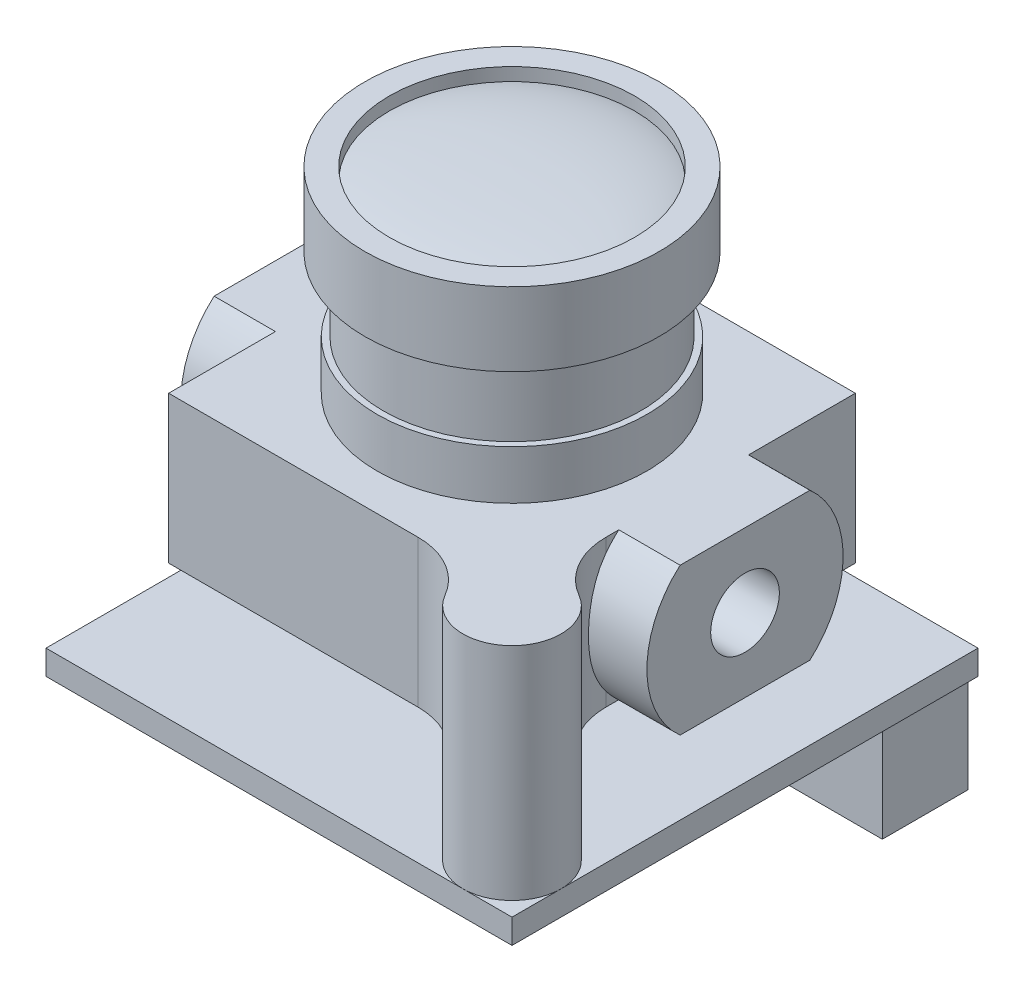
from build123d import *

# Parameters (mm, degrees)
SKETCH1_W            = 19
SKETCH1_H            = 19
BOSS_EXTRUDE1_DEPTH  = 1
SKETCH2_R            = 2
BOSS_EXTRUDE2_DEPTH  = 3
SKETCH3_R            = 2
SKETCH3_W            = 14
SKETCH3_H            = 14
BOSS_EXTRUDE3_DEPTH  = 6
SKETCH4_R            = 1.4
BOSS_EXTRUDE4_DEPTH  = 2.5
BOSS_EXTRUDE5_START  = 2.5
SKETCH5_R            = 1.4
BOSS_EXTRUDE5_DEPTH  = 2.5
SKETCH6_R            = 5.5
BOSS_EXTRUDE6_DEPTH  = 2
SKETCH7_R            = 5.25
BOSS_EXTRUDE7_DEPTH  = 3
SKETCH8_R            = 6
BOSS_EXTRUDE8_DEPTH  = 3
SKETCH12_W           = 9
SKETCH12_H           = 3.5
BOSS_EXTRUDE9_DEPTH  = 4
FILLET1_START        = 4
FILLET1_DEPTH        = 6
SKETCH14_R           = 5.25
BOSS_EXTRUDE11_DEPTH = 0.5


with BuildPart() as part:
    # Sketch1 → Boss-Extrude1 (new body)
    with BuildSketch(Plane(origin=(0, 0, 0), x_dir=(1, 0, 0), z_dir=(0, 1, 0))):
        Rectangle(SKETCH1_W, SKETCH1_H)
    extrude(amount=BOSS_EXTRUDE1_DEPTH)

    # Sketch2 → Boss-Extrude2 (add)
    with BuildSketch(Plane(origin=(0, 1, 0), x_dir=(1, 0, 0), z_dir=(0, 1, 0))):
        with Locations(Location((-7.5, 7.5, 0), (0, 0, 90))):
            Circle(SKETCH2_R)
        with Locations(Location((7.5, -7.5, 0), (0, 0, 90))):
            Circle(SKETCH2_R)
    extrude(amount=BOSS_EXTRUDE2_DEPTH)

    # Sketch3 → Boss-Extrude3 (add)
    with BuildSketch(Plane(origin=(0, 4, 0), x_dir=(1, 0, 0), z_dir=(0, 1, 0))):
        with Locations(Location((7.5, -7.5, 0), (0, 0, 104.477512186))):
            Circle(SKETCH3_R)
        with Locations(Location((-7.5, 7.5, 0), (0, 0, 90))):
            Circle(SKETCH3_R)
        Rectangle(SKETCH3_W, SKETCH3_H)
    extrude(amount=BOSS_EXTRUDE3_DEPTH)

    # Sketch4 → Boss-Extrude4 (add)
    with BuildSketch(Plane.ZY.offset(7)):
        with BuildLine():
            ThreePointArc((4, 7), (3.645751311, 8.645751311), (2.645751311, 10))
            Line((2.645751311, 10), (-2.645751311, 10))
            ThreePointArc((-2.645751311, 10), (-3.645751311, 8.645751311), (-4, 7))
            ThreePointArc((-4, 7), (-3.645751311, 5.354248689), (-2.645751311, 4))
            Line((-2.645751311, 4), (2.645751311, 4))
            ThreePointArc((2.645751311, 4), (3.645751311, 5.354248689), (4, 7))
        make_face()
        with Locations(Location((0, 7, 0), (0, 0, 180))):
            Circle(SKETCH4_R, mode=Mode.SUBTRACT)
    extrude(amount=BOSS_EXTRUDE4_DEPTH)

    # Sketch5 → Boss-Extrude5 (add)
    with BuildSketch(Plane(origin=(7, 0, 0), x_dir=(0, 0, -1), z_dir=(1, 0, 0)).offset(BOSS_EXTRUDE5_START)):
        with BuildLine():
            Line((-2.645751311, 4), (2.645751311, 4))
            ThreePointArc((2.645751311, 4), (4, 7), (2.645751311, 10))
            Line((2.645751311, 10), (-2.645751311, 10))
            ThreePointArc((-2.645751311, 10), (-4, 7), (-2.645751311, 4))
        make_face()
        with Locations((0, 7)):
            Circle(SKETCH5_R, mode=Mode.SUBTRACT)
    extrude(amount=-BOSS_EXTRUDE5_DEPTH)

    # Sketch6 → Boss-Extrude6 (add)
    with BuildSketch(Plane(origin=(0, 10, 0), x_dir=(1, 0, 0), z_dir=(0, 1, 0))):
        with Locations(Location((0, 0, 0), (0, 0, 270))):
            Circle(SKETCH6_R)
    extrude(amount=BOSS_EXTRUDE6_DEPTH)

    # Sketch7 → Boss-Extrude7 (add)
    with BuildSketch(Plane(origin=(0, 12, 0), x_dir=(1, 0, 0), z_dir=(0, 1, 0))):
        with Locations(Location((0, 0, 0), (0, 0, 270))):
            Circle(SKETCH7_R)
    extrude(amount=BOSS_EXTRUDE7_DEPTH)

    # Sketch8 → Boss-Extrude8 (add)
    with BuildSketch(Plane(origin=(0, 15, 0), x_dir=(1, 0, 0), z_dir=(0, 1, 0))):
        with Locations(Location((0, 0, 0), (0, 0, 270))):
            Circle(SKETCH8_R)
    extrude(amount=BOSS_EXTRUDE8_DEPTH)

    # Sketch11 → Cut-Revolve3 (revolve, cut)
    with BuildSketch(Plane.XY):
        with BuildLine():
            Line((-4.998697143, 18), (-4.998697143, 17.468751676))
            add(Edge.make_bspline(
                [(-4.998697143, 17.468751676), (-3.568709189, 17.948183153), (0, 17.967671606)],
                knots=[0, 0, 0, 1, 1, 1], degree=2))
            Line((0, 17.967671606), (0, 18))
            Line((0, 18), (-4.998697143, 18))
        make_face()
    revolve(axis=Axis((0, 18, 0), (0, -1, 0)), mode=Mode.SUBTRACT)

    # Sketch12 → Boss-Extrude9 (add)
    with BuildSketch(Plane.XZ):
        with Locations((4.8, -7.55)):
            Rectangle(SKETCH12_W, SKETCH12_H)
    extrude(amount=BOSS_EXTRUDE9_DEPTH)

    # Fillet1: read off the stored shape, not the designer's step
    # Fillet1 outline → Fillet1 (add)
    with BuildSketch(Plane(origin=(0, 0, 0), x_dir=(1, 0, 0), z_dir=(0, 1, 0)).offset(FILLET1_START)):
        with BuildLine():
            ThreePointArc((-7, 5.563508327), (-7.770090757, 5.518321171), (-8.5, 5.767949192))
            ThreePointArc((-8.5, 5.767949192), (-7.401923789, 4.669872981), (-7, 3.169872981))
            Line((-7, 3.169872981), (-7, 5.563508327))
        make_face()
        with BuildLine():
            ThreePointArc((-3.169872981, 7), (-4.669872981, 7.401923789), (-5.767949192, 8.5))
            ThreePointArc((-5.767949192, 8.5), (-5.518321171, 7.770090757), (-5.563508327, 7))
            Line((-5.563508327, 7), (-3.169872981, 7))
        make_face()
        with BuildLine():
            ThreePointArc((7, -5.563508327), (7.770090757, -5.518321171), (8.5, -5.767949192))
            ThreePointArc((8.5, -5.767949192), (7.401923789, -4.669872981), (7, -3.169872981))
            Line((7, -3.169872981), (7, -5.563508327))
        make_face()
        with BuildLine():
            ThreePointArc((3.169872981, -7), (4.669872981, -7.401923789), (5.767949192, -8.5))
            ThreePointArc((5.767949192, -8.5), (5.518321171, -7.770090757), (5.563508327, -7))
            Line((5.563508327, -7), (3.169872981, -7))
        make_face()
    extrude(amount=FILLET1_DEPTH)


with BuildPart() as body_2:
    # Sketch14 → Boss-Extrude11 (new body)
    with BuildSketch(Plane(origin=(0, 12, 0), x_dir=(1, 0, 0), z_dir=(0, 1, 0))):
        with Locations(Location((0, 0, 0), (0, 0, 270))):
            Circle(SKETCH14_R)
    extrude(amount=BOSS_EXTRUDE11_DEPTH)


solid = Compound([part.part, body_2.part])
